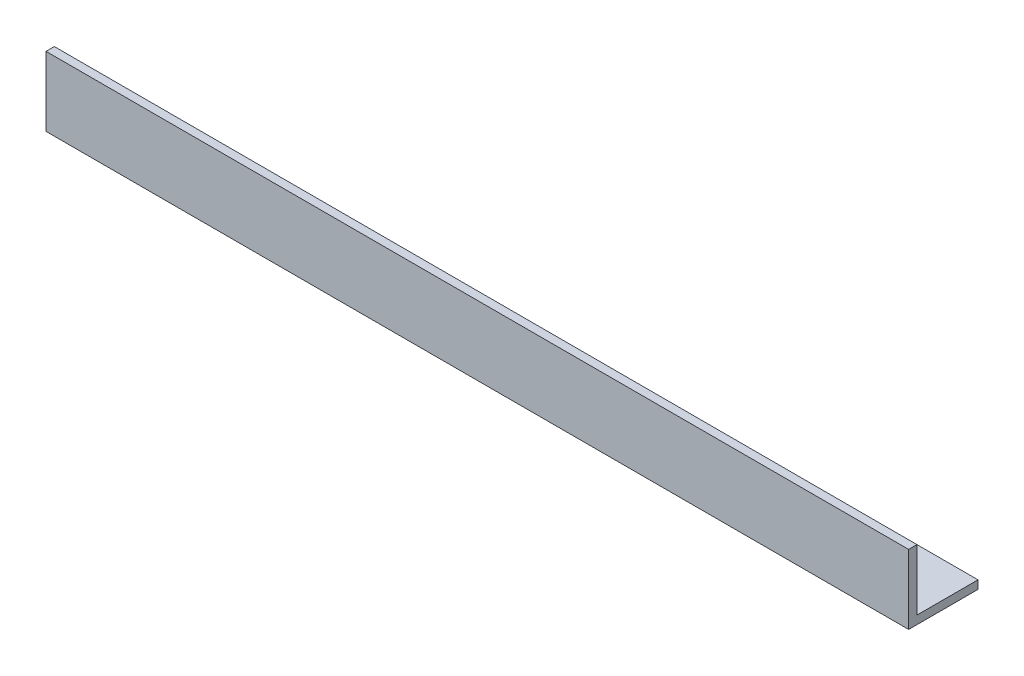
from build123d import *

# Parameters (mm, degrees)
EXTRUDE_2_DEPTH = 622


with BuildPart() as part:
    # Эскиз1 → Вытянуть-Тонкостенный2 (new body)
    with BuildSketch(Plane(origin=(0, 0, 0), x_dir=(0, 0, -1), z_dir=(1, 0, 0))):
        Polygon((0, 50), (0, 0), (50, 0), (50, 6), (6, 6), (6, 50), align=None)
    extrude(amount=EXTRUDE_2_DEPTH)


solid = part.part
